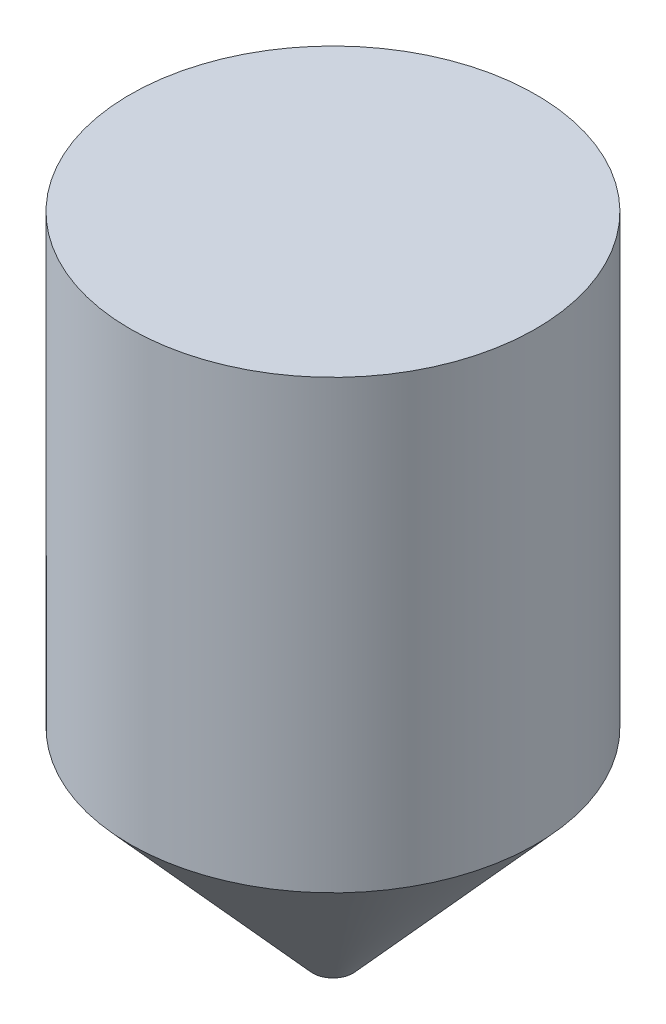
from build123d import *

# Parameters (mm, degrees)
SKETCH1_R           = 1000
BOSS_EXTRUDE1_DEPTH = 2200
SKETCH2_R           = 1000
BOSS_EXTRUDE2_DEPTH = 1000
BOSS_EXTRUDE2_DRAFT = -41.997806383


with BuildPart() as part:
    # Sketch1 → Boss-Extrude1 (new body)
    with BuildSketch(Plane(origin=(0, 0, 0), x_dir=(1, 0, 0), z_dir=(0, 1, 0))):
        Circle(SKETCH1_R)
    extrude(amount=BOSS_EXTRUDE1_DEPTH)


with BuildPart() as body_2:
    # Sketch2 → Boss-Extrude2 (with draft: the straight prism first)
    with BuildSketch(Plane(origin=(0, 0, 0), x_dir=(1, 0, 0), z_dir=(0, 1, 0))):
        Circle(SKETCH2_R)
    extrude(amount=-BOSS_EXTRUDE2_DEPTH)
    # Boss-Extrude2: the draft: its side faces are tilted about the plane it starts from
    boss_extrude2_sides = [body_2.faces().sort_by_distance(p)[0] for p in [
        (-1000, -500, 0),
    ]]
    draft(boss_extrude2_sides, Plane(origin=(0, 0, 0), x_dir=(1, 0, 0), z_dir=(0, 1, 0)), BOSS_EXTRUDE2_DRAFT)


solid = Compound([part.part, body_2.part])
